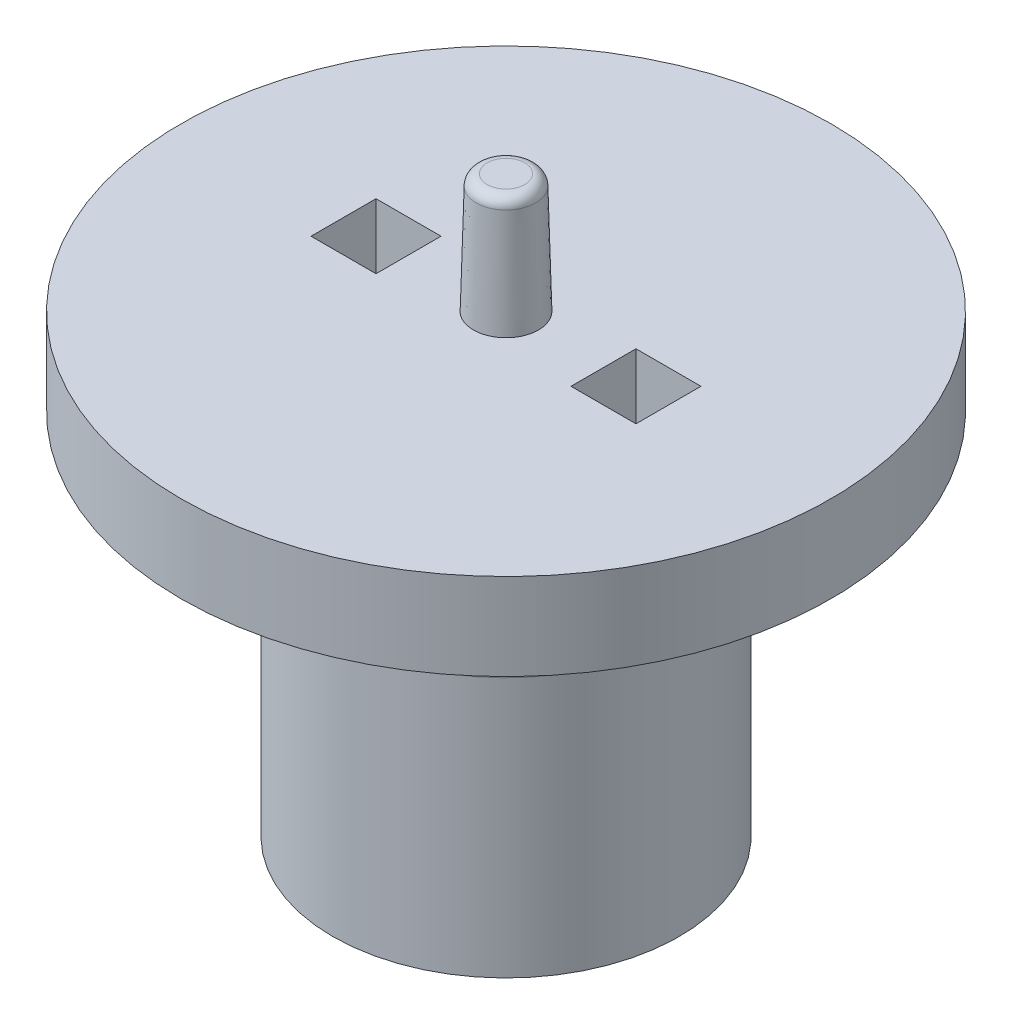
from build123d import *

# Parameters (mm, degrees)
SKETCH1_R           = 8
SKETCH1_R_2         = 2.575
BOSS_EXTRUDE1_DEPTH = 15
SKETCH2_R           = 1.25
CUT_EXTRUDE1_DEPTH  = 19.788294228
SKETCH12_R          = 8
BOSS_EXTRUDE3_DEPTH = 2
SKETCH11_R          = 15
SKETCH11_W          = 3
SKETCH11_H          = 3
BOSS_EXTRUDE2_DEPTH = 4
SKETCH13_R          = 1.5
BOSS_EXTRUDE4_DEPTH = 5.5
BOSS_EXTRUDE4_TAPER = 1.5
FILLET2_R           = 0.5
FILLET4_R           = 5


with BuildPart() as part:
    # Sketch1 → Boss-Extrude1 (new body)
    with BuildSketch(Plane(origin=(0, 0, 0), x_dir=(1, 0, 0), z_dir=(0, 1, 0))):
        Circle(SKETCH1_R)
        Circle(SKETCH1_R_2, mode=Mode.SUBTRACT)
    extrude(amount=BOSS_EXTRUDE1_DEPTH)

    # Sketch2 → Cut-Extrude1 (cut, through all)
    with BuildSketch(Plane.XY):
        with Locations((0, 7.5)):
            Circle(SKETCH2_R)
    extrude(amount=-CUT_EXTRUDE1_DEPTH, mode=Mode.SUBTRACT)

    # Sketch12 → Boss-Extrude3 (add)
    with BuildSketch(Plane(origin=(0, 15, 0), x_dir=(1, 0, 0), z_dir=(0, 1, 0))):
        Circle(SKETCH12_R)
    extrude(amount=BOSS_EXTRUDE3_DEPTH)

    # Sketch11 → Boss-Extrude2 (add)
    with BuildSketch(Plane(origin=(0, 17, 0), x_dir=(1, 0, 0), z_dir=(0, 1, 0))):
        Circle(SKETCH11_R)
        with Locations((-6, 0)):
            Rectangle(SKETCH11_W, SKETCH11_H, mode=Mode.SUBTRACT)
        with Locations((6, 0)):
            Rectangle(SKETCH11_W, SKETCH11_H, mode=Mode.SUBTRACT)
    extrude(amount=BOSS_EXTRUDE2_DEPTH)

    # Sketch13 → Boss-Extrude4 (add)
    with BuildSketch(Plane(origin=(0, 21, 0), x_dir=(1, 0, 0), z_dir=(0, 1, 0))):
        Circle(SKETCH13_R)
    extrude(amount=BOSS_EXTRUDE4_DEPTH, taper=BOSS_EXTRUDE4_TAPER)

    # Fillet2
    fillet2_edges = [part.edges().sort_by_distance(p)[0] for p in [
        (-1.355977431, 26.5, 0),
    ]]
    fillet(fillet2_edges, radius=FILLET2_R)

    # Fillet4
    fillet4_edges = [part.edges().sort_by_distance(p)[0] for p in [
        (-8, 17, 0),
    ]]
    fillet(fillet4_edges, radius=FILLET4_R)


solid = part.part
